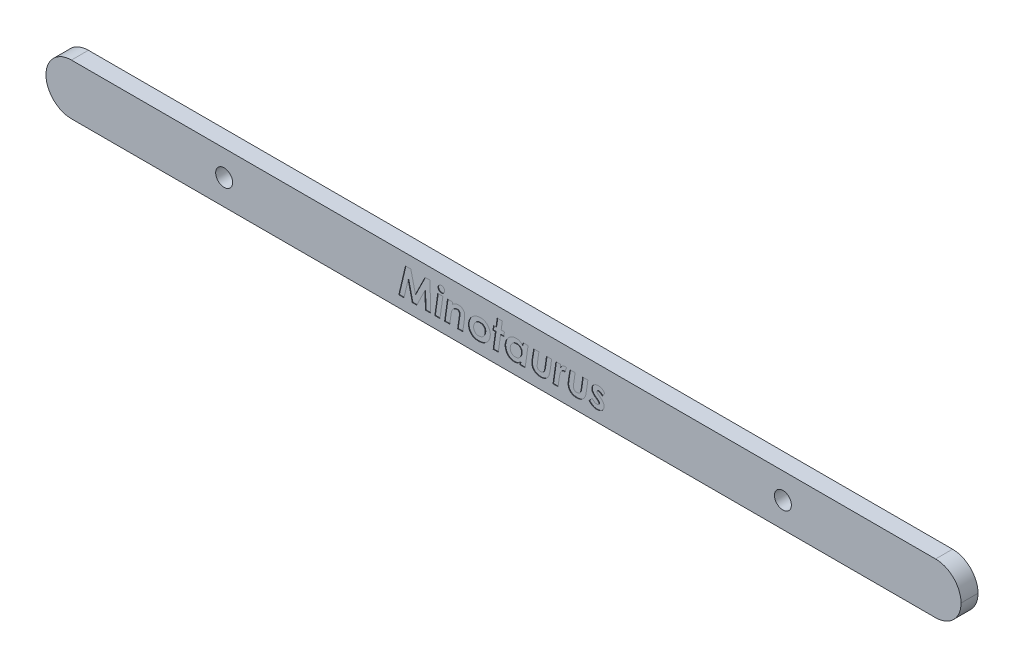
from build123d import *

# Parameters (mm, degrees)
SKETCH1_W           = 161.8
SKETCH1_H           = 9
SKETCH1_R           = 1.5
BOSS_EXTRUDE1_DEPTH = 1.5
CUT_EXTRUDE1_DEPTH  = 0.1
FILLET1_R           = 4.5


with BuildPart() as part:
    # Sketch1 → Boss-Extrude1 (new, symmetric)
    with BuildSketch(Plane.XY):
        Rectangle(SKETCH1_W, SKETCH1_H)
        with Locations((-49.4, 0)):
            Circle(SKETCH1_R, mode=Mode.SUBTRACT)
        with Locations(Location((49.4, 0, 0), (0, 0, 180))):
            Circle(SKETCH1_R, mode=Mode.SUBTRACT)
    extrude(amount=BOSS_EXTRUDE1_DEPTH, both=True)

    # Sketch2 → Cut-Extrude1 (cut)
    # profile 1 of 11: a face of its own
    with BuildSketch(Plane.XY.offset(1.5)):
        Polygon((-17.341746795, 2.5), (-16.387219551, 2.5), (-15.576923077, -0.983573718), (-13.866185897, 2.5), (-12.980769231, 2.5), (-12.916666667, -2.5), (-13.814102564, -2.5), (-13.878205128, 0.490785256), (-15.346554487, -2.5), (-16.12880609, -2.5), (-16.858974359, 0.641025641), (-17.597155449, -2.5), (-18.516626603, -2.5), align=None)
    # profile 2 of 11: a face of its own
    with BuildSketch(Plane.XY.offset(1.5)):
        with BuildLine():
            add(Edge.make_bspline(
                [(-10.993589744, 2.692307692), (-10.955340481, 2.690077294), (-10.880207701, 2.685696137), (-10.771254753, 2.654221817), (-10.672897423, 2.597925678), (-10.584369656, 2.524604703), (-10.511048681, 2.436076935), (-10.454752541, 2.337719606), (-10.423278222, 2.228766658), (-10.418897065, 2.153633878), (-10.416666667, 2.115384615)],
                knots=[0, 0, 0, 0, 1.014134371, 1.992057583, 2.975098753, 4, 5.024901247, 6.007942417, 6.985865629, 8, 8, 8, 8], degree=3))
            add(Edge.make_bspline(
                [(-10.416666667, 2.115384615), (-10.418881857, 2.07712671), (-10.423233142, 2.001976954), (-10.455008269, 1.892864709), (-10.510702831, 1.793815261), (-10.584455418, 1.705267509), (-10.672594884, 1.63163714), (-10.771561664, 1.576770043), (-10.880168513, 1.54500325), (-10.955327261, 1.540668375), (-10.993589744, 1.538461538)],
                knots=[0, 0, 0, 0, 1.013694729, 1.991193998, 2.981551723, 4.006008661, 5.030465598, 6.008806002, 6.986305271, 8, 8, 8, 8], degree=3))
            add(Edge.make_bspline(
                [(-10.993589744, 1.538461538), (-11.031860669, 1.540653281), (-11.107036, 1.544958507), (-11.215805932, 1.577025402), (-11.315458361, 1.631291593), (-11.403622239, 1.70535212), (-11.477682766, 1.793515998), (-11.531948956, 1.893168427), (-11.564015852, 2.001938358), (-11.568321078, 2.07711369), (-11.57051282, 2.115384615)],
                knots=[0, 0, 0, 0, 1.01324697, 1.990314468, 2.975995575, 4, 5.024004425, 6.009685532, 6.98675303, 8, 8, 8, 8], degree=3))
            add(Edge.make_bspline(
                [(-11.57051282, 2.115384615), (-11.568305984, 2.153647098), (-11.563971109, 2.228805846), (-11.532204315, 2.337412695), (-11.477337219, 2.436379474), (-11.40370685, 2.524518941), (-11.315159098, 2.598271528), (-11.21610965, 2.65396609), (-11.106997405, 2.685741217), (-11.031847649, 2.690092502), (-10.993589744, 2.692307692)],
                knots=[0, 0, 0, 0, 1.013694729, 1.991193998, 2.969534402, 3.993991339, 5.018448277, 6.008806002, 6.986305271, 8, 8, 8, 8], degree=3))
        make_face()
    # profile 3 of 11: a face of its own
    with BuildSketch(Plane.XY.offset(1.5)):
        Polygon((-11.628605769, 1.153846154), (-10.723157051, 1.153846154), (-11.241987179, -2.5), (-12.147435897, -2.5), align=None)
    # profile 4 of 11: a face of its own
    with BuildSketch(Plane.XY.offset(1.5)):
        with BuildLine():
            Line((-9.897836538, 1.153846154), (-8.99238782, 1.153846154))
            Line((-8.99238782, 1.153846154), (-9.049479167, 0.750200321))
            add(Edge.make_bspline(
                [(-9.049479167, 0.750200321), (-9.005942073, 0.787268719), (-8.920837085, 0.8597289), (-8.786934185, 0.954704959), (-8.652920318, 1.037238588), (-8.516048923, 1.101798084), (-8.378631589, 1.154115059), (-8.239699744, 1.19087355), (-8.0990785, 1.214182823), (-8.004897128, 1.216692104), (-7.957732372, 1.217948718)],
                knots=[0, 0, 0, 0, 1.129074261, 2.207080079, 3.239806547, 4.233987332, 5.191979582, 6.140686111, 7.068880775, 8, 8, 8, 8], degree=3))
            add(Edge.make_bspline(
                [(-7.957732372, 1.217948718), (-7.918308441, 1.216827834), (-7.84091614, 1.214627451), (-7.727460323, 1.202054601), (-7.619929532, 1.178708635), (-7.517648071, 1.14691481), (-7.421601489, 1.104058417), (-7.329491491, 1.054546635), (-7.244233101, 0.993437846), (-7.16436883, 0.925085265), (-7.092942567, 0.848978599), (-7.028904009, 0.76886072), (-6.975759767, 0.682857502), (-6.931211416, 0.592492625), (-6.897076199, 0.496687941), (-6.873182797, 0.396268657), (-6.858955779, 0.291205672), (-6.856977825, 0.219728949), (-6.855969551, 0.183293269)],
                knots=[0, 0, 0, 0, 1.118022855, 2.194767494, 3.230795032, 4.233728951, 5.225657328, 6.208555818, 7.193457995, 8.193528683, 9.184553253, 10.148487881, 11.096723343, 12.045053303, 13.000209424, 13.973718189, 14.967090947, 16, 16, 16, 16], degree=3))
            add(Edge.make_bspline(
                [(-6.855969551, 0.183293269), (-6.857049995, 0.143886806), (-6.859442235, 0.056635911), (-6.869604792, -0.08746207), (-6.889730838, -0.256907861), (-6.905584868, -0.378624403), (-6.9140625, -0.443709936)],
                knots=[0, 0, 0, 0, 0.750743129, 1.6622403, 2.749928862, 4, 4, 4, 4], degree=3))
            Line((-6.9140625, -0.443709936), (-7.203525641, -2.5))
            Line((-7.203525641, -2.5), (-8.108974359, -2.5))
            Line((-8.108974359, -2.5), (-7.825520833, -0.488782051))
            add(Edge.make_bspline(
                [(-7.825520833, -0.488782051), (-7.819338009, -0.44306526), (-7.807798786, -0.3577424), (-7.794287592, -0.238918377), (-7.78714849, -0.138303355), (-7.78529114, -0.077464367), (-7.784455128, -0.050080128)],
                knots=[0, 0, 0, 0, 1.255630561, 2.343427635, 3.254360171, 4, 4, 4, 4], degree=3))
            add(Edge.make_bspline(
                [(-7.784455128, -0.050080128), (-7.785879838, -0.017216978), (-7.788612233, 0.045809999), (-7.812491347, 0.134808256), (-7.854719884, 0.211242278), (-7.913089188, 0.274351904), (-7.986125522, 0.324138902), (-8.072817258, 0.360484592), (-8.173793883, 0.381114422), (-8.24542887, 0.383405606), (-8.283253205, 0.384615385)],
                knots=[0, 0, 0, 0, 1.048265012, 2.010427263, 2.912347805, 3.810226671, 4.72992967, 5.714049657, 6.792984344, 8, 8, 8, 8], degree=3))
            add(Edge.make_bspline(
                [(-8.283253205, 0.384615385), (-8.322123141, 0.382453068), (-8.400831584, 0.378074553), (-8.51891308, 0.349158331), (-8.635300425, 0.298391737), (-8.750629616, 0.232204938), (-8.859878191, 0.148728845), (-8.956168959, 0.047381229), (-9.040259966, -0.067781397), (-9.098461712, -0.177023717), (-9.139008089, -0.277106708), (-9.169072489, -0.368109068), (-9.197352928, -0.47434445), (-9.226501256, -0.595156139), (-9.25421859, -0.731230547), (-9.28220098, -0.881781599), (-9.309361919, -1.047737486), (-9.325502758, -1.163491548), (-9.333934295, -1.223958333)],
                knots=[0, 0, 0, 0, 0.882065441, 1.786110384, 2.740104157, 3.754965612, 4.797500545, 5.847687264, 6.91599857, 8.024311006, 8.646136181, 9.364850473, 10.197408591, 11.140054438, 12.184569392, 13.348033438, 14.614684545, 16, 16, 16, 16], degree=3))
            Line((-9.333934295, -1.223958333), (-9.511217949, -2.5))
            Line((-9.511217949, -2.5), (-10.416666667, -2.5))
            Line((-10.416666667, -2.5), (-9.897836538, 1.153846154))
        make_face()
    # profile 5 of 11: a face of its own
    with BuildSketch(Plane.XY.offset(1.5)):
        with BuildLine():
            add(Edge.make_bspline(
                [(-4.078525641, 1.217948718), (-4.038095933, 1.217576059), (-3.958080129, 1.216838518), (-3.839458772, 1.204732235), (-3.723302038, 1.188315654), (-3.610167886, 1.164310054), (-3.500156301, 1.132945247), (-3.392801558, 1.094738293), (-3.28783834, 1.0500739), (-3.186718919, 0.997666763), (-3.089532256, 0.939748149), (-2.997168993, 0.875871173), (-2.911167346, 0.805114609), (-2.829115737, 0.730238381), (-2.754470804, 0.647846916), (-2.685203386, 0.560285704), (-2.620476191, 0.467604256), (-2.561813927, 0.369231585), (-2.51015425, 0.265770029), (-2.463502706, 0.159874575), (-2.42538491, 0.049913273), (-2.395028527, -0.06306474), (-2.368877641, -0.178803418), (-2.353086993, -0.297827854), (-2.340791058, -0.419750256), (-2.34009607, -0.502103043), (-2.33974359, -0.543870192)],
                knots=[0, 0, 0, 0, 1.048380346, 2.074885017, 3.090367486, 4.090964834, 5.072523792, 6.056029873, 7.045505985, 8.029469653, 9.008388104, 9.979110116, 10.939576094, 11.895736256, 12.858269977, 13.820062943, 14.790784955, 15.789017664, 16.788414625, 17.789274365, 18.789121639, 19.804049856, 20.823403653, 21.864603227, 22.916983403, 24, 24, 24, 24], degree=3))
            add(Edge.make_bspline(
                [(-2.33974359, -0.543870192), (-2.341790325, -0.612736159), (-2.345821547, -0.748373631), (-2.374086424, -0.947906883), (-2.422393116, -1.13918865), (-2.49002029, -1.322772299), (-2.576526018, -1.498705785), (-2.682269397, -1.667146771), (-2.808484642, -1.826340116), (-2.950791689, -1.976654906), (-3.106945652, -2.114355372), (-3.274383503, -2.234802484), (-3.45095564, -2.336623106), (-3.636221837, -2.420631004), (-3.831532538, -2.484488443), (-4.035439526, -2.530224995), (-4.248285201, -2.559489844), (-4.39326548, -2.562545435), (-4.467147436, -2.564102564)],
                knots=[0, 0, 0, 0, 1.011104245, 1.991457176, 2.952197104, 3.902991464, 4.858928698, 5.826026836, 6.817568841, 7.837123857, 8.861887107, 9.870051414, 10.860623363, 11.850212162, 12.851715058, 13.872153699, 14.915649431, 16, 16, 16, 16], degree=3))
            add(Edge.make_bspline(
                [(-4.467147436, -2.564102564), (-4.530988887, -2.56292756), (-4.655733675, -2.560631628), (-4.837625377, -2.537722776), (-5.009888294, -2.502468818), (-5.172046576, -2.450730704), (-5.324745979, -2.38608649), (-5.467362824, -2.305997024), (-5.600260252, -2.211956786), (-5.720738768, -2.102290987), (-5.830411566, -1.98235813), (-5.925474393, -1.851869157), (-6.006779013, -1.712544348), (-6.071374519, -1.563610758), (-6.122842816, -1.406365258), (-6.159797195, -1.24038889), (-6.182309201, -1.065326), (-6.184684247, -0.945581375), (-6.185897436, -0.884415064)],
                knots=[0, 0, 0, 0, 1.130534475, 2.209039425, 3.242686211, 4.241648197, 5.219495055, 6.175504508, 7.134035888, 8.097337106, 9.056251676, 10.008649417, 10.952170628, 11.908308165, 12.879116703, 13.879338768, 14.916752852, 16, 16, 16, 16], degree=3))
            add(Edge.make_bspline(
                [(-6.185897436, -0.884415064), (-6.183919193, -0.810542353), (-6.180027555, -0.665218491), (-6.150928359, -0.45191634), (-6.100516222, -0.248669773), (-6.030882069, -0.055115131), (-5.942944696, 0.129659096), (-5.832252686, 0.303309475), (-5.703822682, 0.468666002), (-5.556016952, 0.621171597), (-5.395974167, 0.760293376), (-5.227988296, 0.883359469), (-5.051876815, 0.985719732), (-4.870588948, 1.072170656), (-4.681073194, 1.136761856), (-4.486067946, 1.184191509), (-4.284390687, 1.213149248), (-4.147731294, 1.21633528), (-4.078525641, 1.217948718)],
                knots=[0, 0, 0, 0, 1.070407058, 2.105725986, 3.11260329, 4.099768105, 5.082273654, 6.071629737, 7.078227986, 8.111679688, 9.144009435, 10.148605521, 11.124500349, 12.092034995, 13.054511379, 14.020338642, 14.997480131, 16, 16, 16, 16], degree=3))
        make_face()
        with BuildLine():
            add(Edge.make_bspline(
                [(-4.14463141, 0.384615385), (-4.189432678, 0.383525798), (-4.276745607, 0.381402309), (-4.403672181, 0.363030905), (-4.522607741, 0.333102759), (-4.633999083, 0.291203931), (-4.736362228, 0.235302705), (-4.831950381, 0.169020439), (-4.917987643, 0.089074358), (-4.995514776, -0.000799342), (-5.063851615, -0.097714362), (-5.123907856, -0.197420714), (-5.174739366, -0.299516545), (-5.215147457, -0.403743599), (-5.249304992, -0.509420288), (-5.272000601, -0.617517156), (-5.285159879, -0.727839002), (-5.287353278, -0.801914669), (-5.288461538, -0.839342949)],
                knots=[0, 0, 0, 0, 1.147646984, 2.236642535, 3.278363253, 4.285788599, 5.277283386, 6.259990092, 7.25913394, 8.278119336, 9.296601724, 10.294389209, 11.258634566, 12.215104854, 13.156804447, 14.101569642, 15.040778374, 16, 16, 16, 16], degree=3))
            add(Edge.make_bspline(
                [(-5.288461538, -0.839342949), (-5.287628853, -0.872088738), (-5.286001121, -0.936100197), (-5.27513887, -1.029717548), (-5.25585174, -1.118106472), (-5.230149821, -1.201909936), (-5.195578624, -1.280678415), (-5.153864054, -1.354715256), (-5.10379558, -1.423290168), (-5.048431369, -1.4876603), (-4.984936803, -1.544387635), (-4.916977524, -1.594561054), (-4.84404145, -1.637498133), (-4.765368367, -1.671086493), (-4.682030831, -1.698510943), (-4.593706418, -1.717243735), (-4.500487204, -1.728396518), (-4.436797361, -1.729963467), (-4.404046474, -1.730769231)],
                knots=[0, 0, 0, 0, 1.110133544, 2.170088686, 3.189065258, 4.17351184, 5.136579884, 6.099647928, 7.048308506, 8.010844321, 8.972448026, 9.927769731, 10.871216919, 11.834284962, 12.822174017, 13.841150589, 14.889866456, 16, 16, 16, 16], degree=3))
            add(Edge.make_bspline(
                [(-4.404046474, -1.730769231), (-4.357921871, -1.729581379), (-4.268017972, -1.727266073), (-4.137413422, -1.710292959), (-4.015405716, -1.681470681), (-3.902030397, -1.64020587), (-3.797406368, -1.58660117), (-3.7002471, -1.522552571), (-3.612754098, -1.445388294), (-3.533971127, -1.358328799), (-3.464746211, -1.263780802), (-3.404313172, -1.164666312), (-3.351925132, -1.062879982), (-3.309657773, -0.957250764), (-3.277680979, -0.848493451), (-3.254566505, -0.736622223), (-3.240220134, -0.621364323), (-3.238199533, -0.543243365), (-3.237179487, -0.50380609)],
                knots=[0, 0, 0, 0, 1.164111062, 2.269030304, 3.317651816, 4.322802953, 5.30652745, 6.278887004, 7.252451034, 8.242831511, 9.237327035, 10.205734188, 11.170614506, 12.123681709, 13.072978069, 14.028315502, 15.004647829, 16, 16, 16, 16], degree=3))
            add(Edge.make_bspline(
                [(-3.237179487, -0.50380609), (-3.237931773, -0.471719312), (-3.239410475, -0.408649116), (-3.251542813, -0.316373567), (-3.271815814, -0.229012351), (-3.298481092, -0.145671974), (-3.335111331, -0.067919876), (-3.377906113, 0.006369812), (-3.430955929, 0.074232306), (-3.489589023, 0.138226906), (-3.554365827, 0.196401934), (-3.625222227, 0.246546661), (-3.699969992, 0.290023922), (-3.780303445, 0.32402288), (-3.864799988, 0.351037288), (-3.953828241, 0.371438607), (-4.047882857, 0.382103801), (-4.111888563, 0.383765383), (-4.14463141, 0.384615385)],
                knots=[0, 0, 0, 0, 1.079193067, 2.121276228, 3.123935011, 4.093589047, 5.058482656, 6.010079462, 6.971567708, 7.949254825, 8.927715837, 9.893916005, 10.864935156, 11.830939453, 12.821955205, 13.846519011, 14.898362312, 16, 16, 16, 16], degree=3))
        make_face(mode=Mode.SUBTRACT)
    # profile 6 of 11: a face of its own
    with BuildSketch(Plane.XY.offset(1.5)):
        Polygon((-1.115785256, 2.628205128), (-0.211338141, 2.628205128), (-0.415665064, 1.153846154), (0.15625, 1.153846154), (0.048076923, 0.384615385), (-0.522836538, 0.384615385), (-0.922475962, -2.5), (-1.826923077, -2.5), (-1.427283654, 0.384615385), (-1.869991987, 0.384615385), (-1.765825321, 1.153846154), (-1.320112179, 1.153846154), align=None)
    # profile 7 of 11: a face of its own
    with BuildSketch(Plane.XY.offset(1.5)):
        with BuildLine():
            Line((3.435496795, 1.153846154), (4.340945513, 1.153846154))
            Line((4.340945513, 1.153846154), (3.822115385, -2.5))
            Line((3.822115385, -2.5), (2.916666667, -2.5))
            Line((2.916666667, -2.5), (2.979767628, -2.053285256))
            add(Edge.make_bspline(
                [(2.979767628, -2.053285256), (2.932686726, -2.098099875), (2.842911797, -2.183553404), (2.703866381, -2.294415261), (2.570018885, -2.384576939), (2.438060343, -2.453729781), (2.304366223, -2.503901285), (2.165591312, -2.53865166), (2.018913804, -2.560385143), (1.918480739, -2.562842592), (1.866987179, -2.564102564)],
                knots=[0, 0, 0, 0, 1.236324186, 2.357450916, 3.379388742, 4.30284698, 5.185433758, 6.089881904, 7.020653398, 8, 8, 8, 8], degree=3))
            add(Edge.make_bspline(
                [(1.866987179, -2.564102564), (1.808128862, -2.562731379), (1.692857952, -2.560045985), (1.524709511, -2.534059244), (1.365749305, -2.493416538), (1.215902476, -2.436068437), (1.075978698, -2.361212871), (0.944638347, -2.270469996), (0.82306912, -2.162722756), (0.712938289, -2.03939637), (0.613617118, -1.90647408), (0.527227727, -1.766014074), (0.452214203, -1.621302683), (0.393827768, -1.469696183), (0.345630338, -1.314029919), (0.31336518, -1.152227764), (0.29255181, -0.985451427), (0.289835513, -0.872459036), (0.288461538, -0.815304487)],
                knots=[0, 0, 0, 0, 1.072254913, 2.099954687, 3.093402483, 4.05863531, 5.017013142, 5.979305845, 6.962352722, 7.970695896, 8.988290287, 9.983079422, 10.973839091, 11.95483031, 12.940586347, 13.940815436, 14.958409826, 16, 16, 16, 16], degree=3))
            add(Edge.make_bspline(
                [(0.288461538, -0.815304487), (0.289150947, -0.77120185), (0.290522391, -0.683468194), (0.304067715, -0.55260336), (0.326138144, -0.423520569), (0.356450073, -0.295791476), (0.394233526, -0.169451101), (0.441465436, -0.044953503), (0.498121395, 0.077450636), (0.561805332, 0.197907838), (0.632098842, 0.314965279), (0.71095242, 0.424833864), (0.79372732, 0.529521515), (0.883078666, 0.62697559), (0.978781268, 0.716877947), (1.078862313, 0.802063497), (1.186544453, 0.878405221), (1.298035873, 0.949890355), (1.413984187, 1.012134296), (1.531247105, 1.068069389), (1.650730394, 1.113668088), (1.770927265, 1.152267671), (1.892885472, 1.181254144), (2.016009526, 1.202089726), (2.140444148, 1.215917174), (2.223855255, 1.217270842), (2.265625, 1.217948718)],
                knots=[0, 0, 0, 0, 1.010861959, 2.01091412, 3.012605424, 4.011485121, 5.018863341, 6.033918867, 7.061452407, 8.109228878, 9.15680961, 10.18900835, 11.207521355, 12.215190347, 13.216881651, 14.216552911, 15.225616441, 16.240671966, 17.251099115, 18.240697123, 19.217272556, 20.180771028, 21.133199006, 22.08832996, 23.042693801, 24, 24, 24, 24], degree=3))
            add(Edge.make_bspline(
                [(2.265625, 1.217948718), (2.32117344, 1.216366129), (2.430667388, 1.213246619), (2.59103729, 1.18400359), (2.744668655, 1.137752478), (2.891181195, 1.073614092), (3.028774342, 0.9918876), (3.15343014, 0.891217475), (3.26796522, 0.775826328), (3.330571019, 0.686440727), (3.362379808, 0.641025641)],
                knots=[0, 0, 0, 0, 1.030509072, 2.031281277, 3.015697838, 4.003854478, 4.993584726, 5.977161716, 6.972235198, 8, 8, 8, 8], degree=3))
            Line((3.362379808, 0.641025641), (3.435496795, 1.153846154))
        make_face()
        with BuildLine():
            add(Edge.make_bspline(
                [(2.068309295, -1.730769231), (2.120521761, -1.729155419), (2.222345813, -1.726008184), (2.369454298, -1.698128781), (2.506538935, -1.654225901), (2.633392584, -1.591466638), (2.75045149, -1.508925182), (2.856706894, -1.405907235), (2.952677965, -1.282498916), (3.036842963, -1.142418279), (3.107182162, -0.991762781), (3.158718558, -0.836227789), (3.191584704, -0.67879862), (3.19527467, -0.572738911), (3.197115385, -0.519831731)],
                knots=[0, 0, 0, 0, 1.017901168, 1.985097214, 2.910041334, 3.818973104, 4.735274743, 5.693545178, 6.695670165, 7.777101795, 8.875856117, 9.932619244, 10.968700869, 12, 12, 12, 12], degree=3))
            add(Edge.make_bspline(
                [(3.197115385, -0.519831731), (3.196273335, -0.486751761), (3.194618521, -0.42174235), (3.183801447, -0.326809544), (3.16478573, -0.23687996), (3.137501456, -0.152009155), (3.102649895, -0.072105856), (3.059972752, 0.003064183), (3.010079421, 0.072974625), (2.952730901, 0.137565757), (2.88864377, 0.194790813), (2.820693607, 0.24725329), (2.745721462, 0.288449377), (2.667361454, 0.324397964), (2.583472259, 0.35091484), (2.495195551, 0.371575579), (2.401428254, 0.382076956), (2.337427707, 0.383756298), (2.3046875, 0.384615385)],
                knots=[0, 0, 0, 0, 1.109141645, 2.179707075, 3.198451464, 4.18615572, 5.163657463, 6.116161664, 7.079133258, 8.038519567, 9.005387219, 9.956904198, 10.909408399, 11.866440704, 12.843493655, 13.853714903, 14.902043453, 16, 16, 16, 16], degree=3))
            add(Edge.make_bspline(
                [(2.3046875, 0.384615385), (2.266561499, 0.383783167), (2.191295828, 0.38214026), (2.080693828, 0.365172202), (1.974017893, 0.339836808), (1.872300863, 0.301923535), (1.774481439, 0.255194625), (1.682080644, 0.196155773), (1.593302, 0.127745963), (1.510030397, 0.049315722), (1.434076318, -0.037465014), (1.36760027, -0.131083234), (1.31102988, -0.231005098), (1.264934475, -0.337074358), (1.230034613, -0.449745574), (1.203774638, -0.567562826), (1.188650058, -0.692047524), (1.186829751, -0.776869064), (1.185897436, -0.8203125)],
                knots=[0, 0, 0, 0, 0.994897251, 1.964056203, 2.915642991, 3.853470011, 4.79324038, 5.741466074, 6.711095529, 7.716481674, 8.723680824, 9.71796663, 10.70964959, 11.717112863, 12.731868792, 13.785363818, 14.865719672, 16, 16, 16, 16], degree=3))
            add(Edge.make_bspline(
                [(1.185897436, -0.8203125), (1.186754515, -0.853721252), (1.188430604, -0.91905484), (1.198970281, -1.014793869), (1.219495251, -1.10513203), (1.246447068, -1.190657672), (1.280447506, -1.271453156), (1.322795965, -1.347024554), (1.373214771, -1.417512975), (1.430977801, -1.482345487), (1.495298764, -1.540061601), (1.563461752, -1.591921609), (1.636929525, -1.634859669), (1.71469924, -1.670365958), (1.797055704, -1.697346912), (1.883706986, -1.715963336), (1.974452878, -1.72869623), (2.036546387, -1.730067685), (2.068309295, -1.730769231)],
                knots=[0, 0, 0, 0, 1.124431694, 2.198919568, 3.234766021, 4.236791382, 5.213425507, 6.179206721, 7.145706547, 8.12447102, 9.094881178, 10.04988442, 11.001776355, 11.952075609, 12.922030374, 13.911569148, 14.931697721, 16, 16, 16, 16], degree=3))
        make_face(mode=Mode.SUBTRACT)
    # profile 8 of 11: a face of its own
    with BuildSketch(Plane.XY.offset(1.5)):
        with BuildLine():
            Line((5.3515625, 1.153846154), (6.257011218, 1.153846154))
            Line((6.257011218, 1.153846154), (5.990584936, -0.701121795))
            add(Edge.make_bspline(
                [(5.990584936, -0.701121795), (5.9844024, -0.749176833), (5.972865799, -0.838847437), (5.959354232, -0.963682217), (5.952185057, -1.069632252), (5.950350002, -1.13380714), (5.949519231, -1.162860577)],
                knots=[0, 0, 0, 0, 1.253526504, 2.339077935, 3.248062684, 4, 4, 4, 4], degree=3))
            add(Edge.make_bspline(
                [(5.949519231, -1.162860577), (5.951131699, -1.201520585), (5.954290855, -1.277263483), (5.988401198, -1.384890603), (6.040080811, -1.484022937), (6.113376603, -1.570134938), (6.202706614, -1.642231489), (6.307046135, -1.693575135), (6.423372784, -1.725890236), (6.505187445, -1.729106699), (6.547475962, -1.730769231)],
                knots=[0, 0, 0, 0, 1.002835694, 1.964761131, 2.909147679, 3.895784594, 4.884866332, 5.875587295, 6.90192956, 8, 8, 8, 8], degree=3))
            add(Edge.make_bspline(
                [(6.547475962, -1.730769231), (6.575217389, -1.730295765), (6.6292253, -1.729374006), (6.70776254, -1.719236082), (6.781151439, -1.702137111), (6.849641185, -1.679107625), (6.913421238, -1.650113035), (6.972046805, -1.613807723), (7.025065149, -1.570276093), (7.075093204, -1.520242088), (7.119226752, -1.458236618), (7.161538098, -1.385102894), (7.198870166, -1.297589481), (7.235293648, -1.19754573), (7.266426769, -1.083088963), (7.295508396, -0.955451396), (7.32136, -0.814398052), (7.335425628, -0.715533047), (7.342748397, -0.6640625)],
                knots=[0, 0, 0, 0, 0.892108868, 1.736786517, 2.541881516, 3.312938247, 4.057891121, 4.791136306, 5.524224126, 6.261001152, 7.060198994, 7.964829526, 8.974738879, 10.116351085, 11.388184609, 12.787440625, 14.327495265, 16, 16, 16, 16], degree=3))
            Line((7.342748397, -0.6640625), (7.602163462, 1.153846154))
            Line((7.602163462, 1.153846154), (8.508613782, 1.153846154))
            Line((8.508613782, 1.153846154), (8.229166667, -0.802283654))
            add(Edge.make_bspline(
                [(8.229166667, -0.802283654), (8.221199734, -0.855430478), (8.205670556, -0.959024478), (8.176647053, -1.109403812), (8.143265627, -1.250551363), (8.108292627, -1.38309263), (8.066376424, -1.505297357), (8.02315994, -1.619294862), (7.973611264, -1.723212538), (7.905436693, -1.849197214), (7.806952526, -1.99024851), (7.671627059, -2.140769457), (7.517536652, -2.269636506), (7.345721272, -2.376235671), (7.157794339, -2.461526681), (6.953049273, -2.520777746), (6.732776631, -2.557795858), (6.580682002, -2.561959614), (6.502403846, -2.564102564)],
                knots=[0, 0, 0, 0, 0.938282912, 1.828904783, 2.673080473, 3.47068305, 4.220973376, 4.927886656, 5.59807994, 6.229421123, 7.427669869, 8.591533972, 9.754419504, 10.92230609, 12.112044702, 13.346047806, 14.63409719, 16, 16, 16, 16], degree=3))
            add(Edge.make_bspline(
                [(6.502403846, -2.564102564), (6.446927621, -2.563020966), (6.33867367, -2.56091038), (6.180568407, -2.542345659), (6.031228848, -2.513032837), (5.891004843, -2.470241032), (5.758592615, -2.417584935), (5.635617952, -2.351242459), (5.520814255, -2.273431612), (5.41650077, -2.183555038), (5.322380683, -2.08442307), (5.239636716, -1.978036894), (5.170044984, -1.864159532), (5.113814577, -1.743022173), (5.069813972, -1.615421505), (5.037408266, -1.481032296), (5.018111718, -1.339373983), (5.016066989, -1.242381419), (5.015024038, -1.192908654)],
                knots=[0, 0, 0, 0, 1.168632583, 2.280420012, 3.349725486, 4.371307417, 5.365511249, 6.347568045, 7.309587773, 8.282530155, 9.242979364, 10.185822766, 11.117310968, 12.048958566, 12.994554036, 13.956959565, 14.957911239, 16, 16, 16, 16], degree=3))
            add(Edge.make_bspline(
                [(5.015024038, -1.192908654), (5.015602076, -1.160522224), (5.016794239, -1.09372747), (5.020419002, -0.990142005), (5.028927004, -0.879975771), (5.040008963, -0.762782091), (5.053608696, -0.638790922), (5.072593513, -0.508453261), (5.091700149, -0.371315371), (5.107899246, -0.278068859), (5.116185897, -0.23036859)],
                knots=[0, 0, 0, 0, 0.80233306, 1.654755999, 2.566827454, 3.538651181, 4.570611162, 5.655930814, 6.800891005, 8, 8, 8, 8], degree=3))
            Line((5.116185897, -0.23036859), (5.3515625, 1.153846154))
        make_face()
    # profile 9 of 11: a face of its own
    with BuildSketch(Plane.XY.offset(1.5)):
        with BuildLine():
            Line((9.268830128, 1.153846154), (10.110176282, 1.153846154))
            Line((10.110176282, 1.153846154), (10.045072115, 0.641025641))
            add(Edge.make_bspline(
                [(10.045072115, 0.641025641), (10.075306678, 0.686681728), (10.133571345, 0.774665031), (10.231219341, 0.892802791), (10.333576726, 0.992668464), (10.440393067, 1.075181079), (10.552348452, 1.13896036), (10.668965732, 1.184701495), (10.790266623, 1.21283375), (10.872916576, 1.216237645), (10.914463141, 1.217948718)],
                knots=[0, 0, 0, 0, 1.203274242, 2.318815539, 3.362160423, 4.341361458, 5.27818761, 6.184615762, 7.087440759, 8, 8, 8, 8], degree=3))
            add(Edge.make_bspline(
                [(10.914463141, 1.217948718), (10.934885325, 1.217140876), (10.976732466, 1.215485525), (11.039891789, 1.20274018), (11.104471746, 1.182846004), (11.146359245, 1.163685252), (11.16786859, 1.153846154)],
                knots=[0, 0, 0, 0, 0.929430428, 1.904497954, 2.92395396, 4, 4, 4, 4], degree=3))
            Line((11.16786859, 1.153846154), (10.813301282, 0.340544872))
            add(Edge.make_bspline(
                [(10.813301282, 0.340544872), (10.796991777, 0.347018322), (10.766943213, 0.358944981), (10.724746972, 0.37358655), (10.689081235, 0.381943127), (10.667428191, 0.383807954), (10.658052885, 0.384615385)],
                knots=[0, 0, 0, 0, 1.298729578, 2.392773935, 3.304105365, 4, 4, 4, 4], degree=3))
            add(Edge.make_bspline(
                [(10.658052885, 0.384615385), (10.635603615, 0.383626522), (10.591264066, 0.381673419), (10.525927067, 0.366744708), (10.46214705, 0.3435947), (10.399853576, 0.310548767), (10.340568871, 0.266239269), (10.28233473, 0.214164296), (10.22600239, 0.152422837), (10.17104731, 0.080146051), (10.117729926, -0.006284031), (10.070779711, -0.111905259), (10.024998165, -0.235431992), (9.980649817, -0.377996099), (9.941824354, -0.540585399), (9.90357023, -0.721852389), (9.868691646, -0.922324632), (9.849007935, -1.062637691), (9.838741987, -1.135817308)],
                knots=[0, 0, 0, 0, 0.576935763, 1.139505725, 1.715418098, 2.31853603, 2.945453378, 3.61436612, 4.325438415, 5.091425351, 5.947081821, 6.930670679, 8.058330957, 9.334895625, 10.767784451, 12.355934311, 14.099454639, 16, 16, 16, 16], degree=3))
            Line((9.838741987, -1.135817308), (9.655448718, -2.5))
            Line((9.655448718, -2.5), (8.75, -2.5))
            Line((8.75, -2.5), (9.268830128, 1.153846154))
        make_face()
    # profile 10 of 11: a face of its own
    with BuildSketch(Plane.XY.offset(1.5)):
        with BuildLine():
            Line((11.76181891, 1.153846154), (12.667267628, 1.153846154))
            Line((12.667267628, 1.153846154), (12.400841346, -0.701121795))
            add(Edge.make_bspline(
                [(12.400841346, -0.701121795), (12.39465881, -0.749176833), (12.38312221, -0.838847437), (12.369610642, -0.963682217), (12.362441467, -1.069632252), (12.360606412, -1.13380714), (12.359775641, -1.162860577)],
                knots=[0, 0, 0, 0, 1.253526504, 2.339077935, 3.248062684, 4, 4, 4, 4], degree=3))
            add(Edge.make_bspline(
                [(12.359775641, -1.162860577), (12.361388109, -1.201520585), (12.364547266, -1.277263483), (12.398657608, -1.384890603), (12.450337222, -1.484022937), (12.523633013, -1.570134938), (12.612963025, -1.642231489), (12.717302546, -1.693575135), (12.833629194, -1.725890236), (12.915443856, -1.729106699), (12.957732372, -1.730769231)],
                knots=[0, 0, 0, 0, 1.002835694, 1.964761131, 2.909147679, 3.895784594, 4.884866332, 5.875587295, 6.90192956, 8, 8, 8, 8], degree=3))
            add(Edge.make_bspline(
                [(12.957732372, -1.730769231), (12.985473799, -1.730295765), (13.03948171, -1.729374006), (13.11801895, -1.719236082), (13.19140785, -1.702137111), (13.259897595, -1.679107625), (13.323677648, -1.650113035), (13.382303216, -1.613807723), (13.435321559, -1.570276093), (13.485349615, -1.520242088), (13.529483162, -1.458236618), (13.571794508, -1.385102894), (13.609126576, -1.297589481), (13.645550058, -1.19754573), (13.676683179, -1.083088963), (13.705764806, -0.955451396), (13.73161641, -0.814398052), (13.745682039, -0.715533047), (13.753004808, -0.6640625)],
                knots=[0, 0, 0, 0, 0.892108868, 1.736786517, 2.541881516, 3.312938247, 4.057891121, 4.791136306, 5.524224126, 6.261001152, 7.060198994, 7.964829526, 8.974738879, 10.116351085, 11.388184609, 12.787440625, 14.327495265, 16, 16, 16, 16], degree=3))
            Line((13.753004808, -0.6640625), (14.012419872, 1.153846154))
            Line((14.012419872, 1.153846154), (14.918870192, 1.153846154))
            Line((14.918870192, 1.153846154), (14.639423077, -0.802283654))
            add(Edge.make_bspline(
                [(14.639423077, -0.802283654), (14.631456144, -0.855430478), (14.615926967, -0.959024478), (14.586903464, -1.109403812), (14.553522038, -1.250551363), (14.518549038, -1.38309263), (14.476632835, -1.505297357), (14.433416351, -1.619294862), (14.383867674, -1.723212538), (14.315693103, -1.849197214), (14.217208937, -1.99024851), (14.08188347, -2.140769457), (13.927793062, -2.269636506), (13.755977682, -2.376235671), (13.568050749, -2.461526681), (13.363305683, -2.520777746), (13.143033042, -2.557795858), (12.990938412, -2.561959614), (12.912660256, -2.564102564)],
                knots=[0, 0, 0, 0, 0.938282912, 1.828904783, 2.673080473, 3.47068305, 4.220973376, 4.927886656, 5.59807994, 6.229421123, 7.427669869, 8.591533972, 9.754419504, 10.92230609, 12.112044702, 13.346047806, 14.63409719, 16, 16, 16, 16], degree=3))
            add(Edge.make_bspline(
                [(12.912660256, -2.564102564), (12.857184031, -2.563020966), (12.748930081, -2.56091038), (12.590824817, -2.542345659), (12.441485258, -2.513032837), (12.301261254, -2.470241032), (12.168849026, -2.417584935), (12.045874362, -2.351242459), (11.931070665, -2.273431612), (11.82675718, -2.183555038), (11.732637094, -2.08442307), (11.649893127, -1.978036894), (11.580301394, -1.864159532), (11.524070987, -1.743022173), (11.480070383, -1.615421505), (11.447664677, -1.481032296), (11.428368128, -1.339373983), (11.426323399, -1.242381419), (11.425280449, -1.192908654)],
                knots=[0, 0, 0, 0, 1.168632583, 2.280420012, 3.349725486, 4.371307417, 5.365511249, 6.347568045, 7.309587773, 8.282530155, 9.242979364, 10.185822766, 11.117310968, 12.048958566, 12.994554036, 13.956959565, 14.957911239, 16, 16, 16, 16], degree=3))
            add(Edge.make_bspline(
                [(11.425280449, -1.192908654), (11.425858487, -1.160522224), (11.42705065, -1.09372747), (11.430675413, -0.990142005), (11.439183414, -0.879975771), (11.450265373, -0.762782091), (11.463865107, -0.638790922), (11.482849923, -0.508453261), (11.501956559, -0.371315371), (11.518155657, -0.278068859), (11.526442308, -0.23036859)],
                knots=[0, 0, 0, 0, 0.80233306, 1.654755999, 2.566827454, 3.538651181, 4.570611162, 5.655930814, 6.800891005, 8, 8, 8, 8], degree=3))
            Line((11.526442308, -0.23036859), (11.76181891, 1.153846154))
        make_face()
    # profile 11 of 11: a face of its own
    with BuildSketch(Plane.XY.offset(1.5)):
        with BuildLine():
            Line((17.903645833, 0.611979167), (17.477964744, -0.075120192))
            add(Edge.make_bspline(
                [(17.477964744, -0.075120192), (17.450861991, -0.037921711), (17.398687235, 0.033688051), (17.313476362, 0.129617116), (17.225357502, 0.209156374), (17.135574538, 0.272802223), (17.046920322, 0.321667215), (16.960856128, 0.357773213), (16.877141435, 0.380188963), (16.821703641, 0.383171729), (16.794871795, 0.384615385)],
                knots=[0, 0, 0, 0, 1.293875212, 2.490803217, 3.601185646, 4.625026071, 5.578970932, 6.442087991, 7.245971894, 8, 8, 8, 8], degree=3))
            add(Edge.make_bspline(
                [(16.794871795, 0.384615385), (16.775450135, 0.383862986), (16.737549039, 0.38239469), (16.68280191, 0.370444815), (16.632986199, 0.349084514), (16.589890037, 0.320223432), (16.553155127, 0.287716738), (16.527084673, 0.251319673), (16.508902581, 0.212925233), (16.507241031, 0.185825505), (16.506410256, 0.172275641)],
                knots=[0, 0, 0, 0, 1.182476273, 2.30758579, 3.391877461, 4.463697876, 5.456992938, 6.360200449, 7.180100224, 8, 8, 8, 8], degree=3))
            add(Edge.make_bspline(
                [(16.506410256, 0.172275641), (16.507096658, 0.15912537), (16.508502814, 0.132185833), (16.523414209, 0.092782636), (16.542545908, 0.051987511), (16.562252936, 0.027681961), (16.572516026, 0.015024038)],
                knots=[0, 0, 0, 0, 0.903144459, 1.85017425, 2.880406844, 4, 4, 4, 4], degree=3))
            add(Edge.make_bspline(
                [(16.572516026, 0.015024038), (16.579065729, 0.007554169), (16.594032715, -0.009515526), (16.622863148, -0.035199344), (16.658898476, -0.066263491), (16.702751069, -0.102312519), (16.755195763, -0.141821567), (16.814115982, -0.187692613), (16.882592638, -0.236171153), (16.930763482, -0.270424198), (16.956129808, -0.288461538)],
                knots=[0, 0, 0, 0, 0.486262068, 1.111176692, 1.888157049, 2.817936484, 3.890888726, 5.104451828, 6.475230771, 8, 8, 8, 8], degree=3))
            add(Edge.make_bspline(
                [(16.956129808, -0.288461538), (16.997033187, -0.31760578), (17.075952447, -0.373836878), (17.187266982, -0.458934885), (17.287157387, -0.541137754), (17.377368895, -0.61891401), (17.454883774, -0.695496386), (17.523849606, -0.766743992), (17.580174646, -0.836543705), (17.641358968, -0.923374782), (17.699494697, -1.034516877), (17.751964025, -1.171692326), (17.782721014, -1.31541708), (17.786538436, -1.413119955), (17.788461538, -1.462339744)],
                knots=[0, 0, 0, 0, 1.202285104, 2.319697097, 3.353301761, 4.299159753, 5.169575473, 5.96111865, 6.671375532, 7.314364668, 8.50149111, 9.6623909, 10.822382393, 12, 12, 12, 12], degree=3))
            add(Edge.make_bspline(
                [(17.788461538, -1.462339744), (17.78758764, -1.495128811), (17.78583821, -1.560768184), (17.768853602, -1.65805454), (17.742992326, -1.75422117), (17.705217138, -1.848535983), (17.658045751, -1.942295169), (17.599658338, -2.03426401), (17.530806217, -2.124857678), (17.452978948, -2.213495699), (17.364017448, -2.295448526), (17.265789478, -2.368277306), (17.156969661, -2.428359595), (17.039516974, -2.479159282), (16.911412256, -2.51617668), (16.77491633, -2.544804834), (16.628626346, -2.560329549), (16.528144654, -2.562819425), (16.476362179, -2.564102564)],
                knots=[0, 0, 0, 0, 0.823882478, 1.649303646, 2.476260642, 3.324427264, 4.199309487, 5.112434692, 6.059514339, 7.058678777, 8.074738792, 9.095747378, 10.125726673, 11.194005657, 12.30701197, 13.472823075, 14.697638618, 16, 16, 16, 16], degree=3))
            add(Edge.make_bspline(
                [(16.476362179, -2.564102564), (16.416172114, -2.562397838), (16.297835414, -2.55904626), (16.12454459, -2.531810757), (15.959984682, -2.484792526), (15.828076827, -2.43222377), (15.725133585, -2.37910535), (15.647002777, -2.329976835), (15.565585605, -2.275280597), (15.482839577, -2.21179086), (15.397296075, -2.141330969), (15.309628801, -2.063632817), (15.220025524, -1.977838152), (15.160750344, -1.917240865), (15.130208333, -1.886017628)],
                knots=[0, 0, 0, 0, 1.3917013, 2.736154834, 4.044007326, 5.343168153, 6.013207005, 6.720436798, 7.476485983, 8.281134576, 9.131434638, 10.039487272, 10.989830126, 12, 12, 12, 12], degree=3))
            Line((15.130208333, -1.886017628), (15.682091346, -1.251001603))
            add(Edge.make_bspline(
                [(15.682091346, -1.251001603), (15.713239296, -1.2888922), (15.77363145, -1.36235754), (15.870608926, -1.460845883), (15.970251293, -1.543805412), (16.072306951, -1.611666618), (16.176163266, -1.665486139), (16.283146852, -1.702596725), (16.39176409, -1.727263883), (16.465546155, -1.729601486), (16.502403846, -1.730769231)],
                knots=[0, 0, 0, 0, 1.194983961, 2.316931099, 3.362897671, 4.349081709, 5.298844883, 6.204687641, 7.103155112, 8, 8, 8, 8], degree=3))
            add(Edge.make_bspline(
                [(16.502403846, -1.730769231), (16.530544018, -1.730015613), (16.584329327, -1.728575196), (16.660331453, -1.712037225), (16.728000445, -1.686420051), (16.785028351, -1.649090691), (16.831137145, -1.604965887), (16.86660137, -1.557122517), (16.886739665, -1.503200912), (16.889579804, -1.466168093), (16.891025641, -1.447315705)],
                knots=[0, 0, 0, 0, 1.262863261, 2.413755393, 3.478337955, 4.49818724, 5.453495978, 6.336264993, 7.153038342, 8, 8, 8, 8], degree=3))
            add(Edge.make_bspline(
                [(16.891025641, -1.447315705), (16.890026026, -1.431832881), (16.88796059, -1.399841765), (16.871343151, -1.352391495), (16.847548266, -1.303506536), (16.817288686, -1.263609325), (16.786344428, -1.228534394), (16.753579683, -1.197387529), (16.712499559, -1.161695971), (16.663372687, -1.12066478), (16.60607373, -1.074416619), (16.540187924, -1.023339389), (16.46481836, -0.968686144), (16.411931532, -0.930479806), (16.384214744, -0.910456731)],
                knots=[0, 0, 0, 0, 0.730705261, 1.509807026, 2.357288366, 3.29541125, 3.865889586, 4.569470673, 5.431105645, 6.440057403, 7.596752151, 8.913931468, 10.38266143, 12, 12, 12, 12], degree=3))
            add(Edge.make_bspline(
                [(16.384214744, -0.910456731), (16.351732067, -0.886885677), (16.288604699, -0.841077305), (16.198842788, -0.772591235), (16.117547, -0.705824133), (16.042978156, -0.64323194), (15.977133281, -0.58207143), (15.918528259, -0.524045686), (15.868294081, -0.468216448), (15.839137677, -0.430523075), (15.825320513, -0.412660256)],
                knots=[0, 0, 0, 0, 1.282428707, 2.492293047, 3.606974981, 4.643787634, 5.602579517, 6.477648517, 7.278560515, 8, 8, 8, 8], degree=3))
            add(Edge.make_bspline(
                [(15.825320513, -0.412660256), (15.792407976, -0.364476429), (15.728257909, -0.270560979), (15.659541108, -0.117443575), (15.617528222, 0.040163685), (15.611822893, 0.146986466), (15.608974359, 0.200320513)],
                knots=[0, 0, 0, 0, 1.057832104, 2.061828311, 3.032317477, 4, 4, 4, 4], degree=3))
            add(Edge.make_bspline(
                [(15.608974359, 0.200320513), (15.609712094, 0.237124536), (15.611162466, 0.309480435), (15.62922286, 0.414790991), (15.655815666, 0.515135706), (15.694563252, 0.60959719), (15.7425194, 0.69999058), (15.803527993, 0.783872431), (15.873669422, 0.863721369), (15.954883181, 0.936283283), (16.043489328, 1.001081158), (16.135573044, 1.060539528), (16.233600022, 1.108005569), (16.334547374, 1.148355422), (16.439453221, 1.17971011), (16.548464349, 1.201292188), (16.661245246, 1.216237907), (16.738064822, 1.217374814), (16.776842949, 1.217948718)],
                knots=[0, 0, 0, 0, 1.021630065, 2.008502182, 2.960568009, 3.90126412, 4.839440403, 5.797185411, 6.776483436, 7.788164727, 8.816178467, 9.825218622, 10.829341502, 11.837229321, 12.844091735, 13.866690309, 14.923116238, 16, 16, 16, 16], degree=3))
            add(Edge.make_bspline(
                [(16.776842949, 1.217948718), (16.831377055, 1.215910769), (16.940211654, 1.211843601), (17.101395467, 1.182435484), (17.257727378, 1.13129747), (17.408715577, 1.062313503), (17.552045166, 0.97584661), (17.682717785, 0.870231668), (17.802569962, 0.750074609), (17.869722252, 0.658327439), (17.903645833, 0.611979167)],
                knots=[0, 0, 0, 0, 0.983198209, 1.962184592, 2.942724805, 3.942248462, 4.950006518, 5.952318655, 6.965564907, 8, 8, 8, 8], degree=3))
        make_face()
    extrude(amount=-CUT_EXTRUDE1_DEPTH, mode=Mode.SUBTRACT)

    # Fillet1
    fillet1_edges = [part.edges().sort_by_distance(p)[0] for p in [
        (80.9, -4.5, 0),
        (80.9, 4.5, 0),
        (-80.9, -4.5, 0),
        (-80.9, 4.5, 0),
    ]]
    fillet(fillet1_edges, radius=FILLET1_R - 0.0001)  # a hair under: the kernel refuses the full size


solid = part.part
